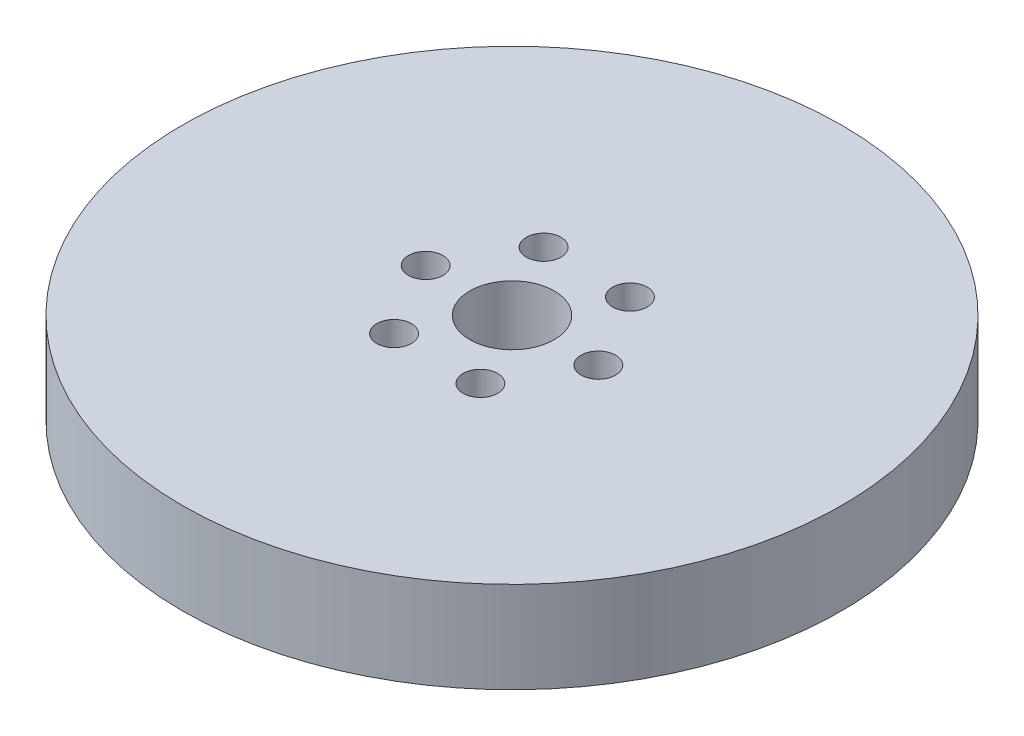
from build123d import *

# Parameters (mm, degrees)
SKETCH1_R           = 97.5
BOSS_EXTRUDE1_DEPTH = 27
SKETCH2_R           = 12.5
CUT_EXTRUDE1_DEPTH  = 141.504448328
SKETCH3_R           = 5.117535423
CUT_EXTRUDE2_DEPTH  = 26.788077133
CIRPATTERN1_COUNT   = 6


with BuildPart() as part:
    # Sketch1 → Boss-Extrude1 (new body)
    with BuildSketch(Plane(origin=(0, 0, 0), x_dir=(1, 0, 0), z_dir=(0, 1, 0))):
        Circle(SKETCH1_R)
    extrude(amount=BOSS_EXTRUDE1_DEPTH)

    # Sketch2 → Cut-Extrude1 (cut, through all)
    with BuildSketch(Plane(origin=(0, 0, 0), x_dir=(1, 0, 0), z_dir=(0, 1, 0))):
        Circle(SKETCH2_R)
    extrude(amount=CUT_EXTRUDE1_DEPTH, mode=Mode.SUBTRACT)

    # Sketch3 → Cut-Extrude2 (cut)
    with BuildSketch(Plane(origin=(0, 27, 0), x_dir=(1, 0, 0), z_dir=(0, 1, 0))):
        with Locations((-25.542166519, 0)):
            Circle(SKETCH3_R)
    cut_extrude2 = extrude(amount=-CUT_EXTRUDE2_DEPTH, mode=Mode.SUBTRACT)

    # CirPattern1: Cut-Extrude2 ×6 about axis
    cirpattern1_axis = Axis((0, 0, 0), (0, 1, 0))
    for i in range(1, CIRPATTERN1_COUNT):
        add(cut_extrude2.rotate(cirpattern1_axis, i * 360 / CIRPATTERN1_COUNT), mode=Mode.SUBTRACT)


solid = part.part
